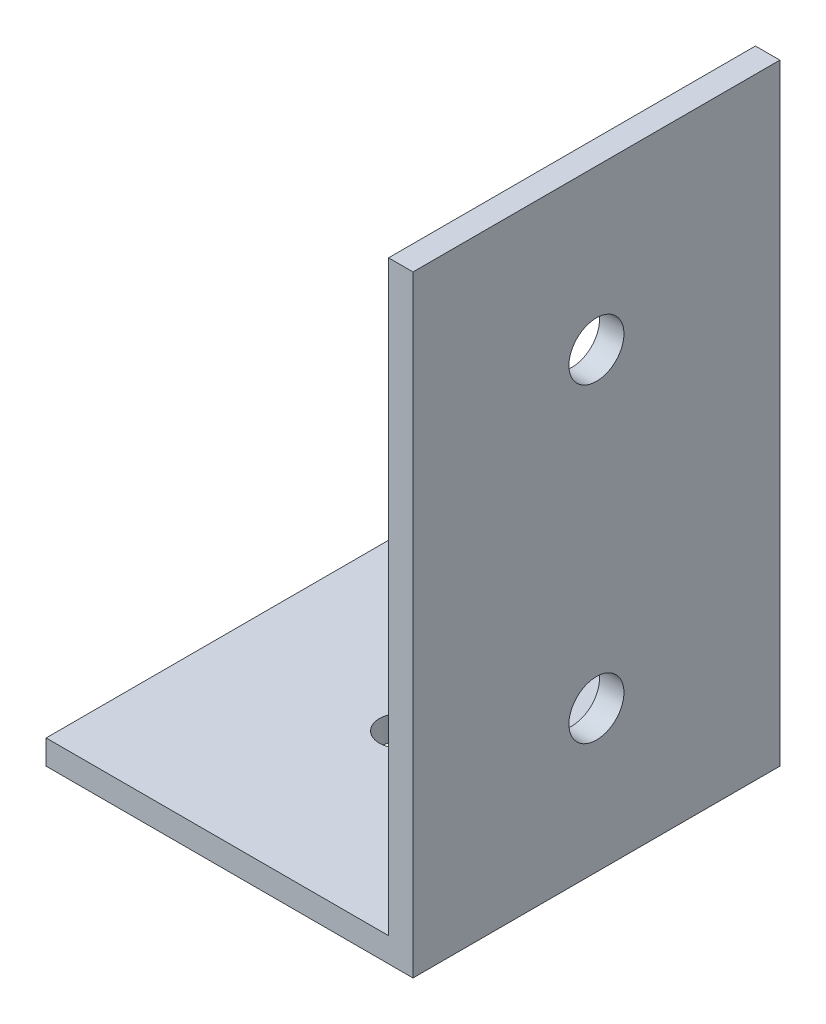
from build123d import *

# Parameters (mm, degrees)
ESTRUSIONE_ESTRUSIONE1_DEPTH = 30
SCHIZZO2_R                   = 2.25
TAGLIO_ESTRUSIONE1_DEPTH     = 65.683846515
SCHIZZO3_R                   = 1.75
TAGLIO_ESTRUSIONE2_DEPTH     = 65.062469512


with BuildPart() as part:
    # Schizzo1 → Estrusione-Estrusione1 (new body)
    with BuildSketch(Plane.XY):
        Polygon((0, 0), (-30, 0), (-30, 2), (-2, 2), (-2, 50), (0, 50), align=None)
    extrude(amount=ESTRUSIONE_ESTRUSIONE1_DEPTH)

    # Schizzo2 → Taglio-Estrusione1 (cut, through all)
    with BuildSketch(Plane.ZY.offset(2)):
        with Locations((15, 37)):
            Circle(SCHIZZO2_R)
        with Locations((15, 11.6)):
            Circle(SCHIZZO2_R)
    extrude(amount=-TAGLIO_ESTRUSIONE1_DEPTH, mode=Mode.SUBTRACT)

    # Schizzo3 → Taglio-Estrusione2 (cut, through all)
    with BuildSketch(Plane(origin=(0, 2, 0), x_dir=(1, 0, 0), z_dir=(0, 1, 0))):
        with Locations((-16, -15)):
            Circle(SCHIZZO3_R)
    extrude(amount=-TAGLIO_ESTRUSIONE2_DEPTH, mode=Mode.SUBTRACT)


solid = part.part
